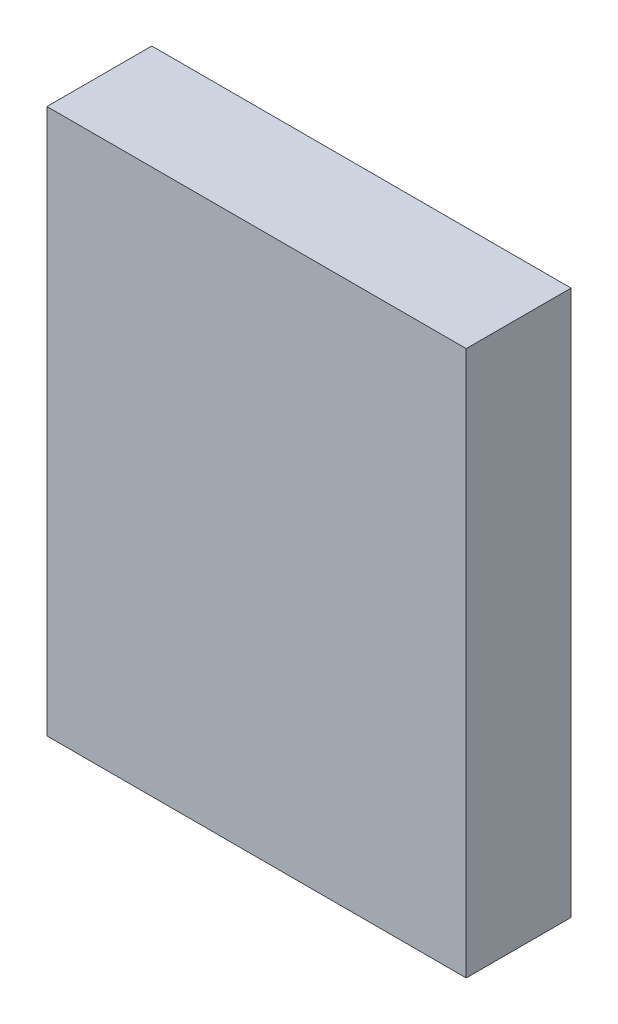
from build123d import *

# Parameters (mm, degrees)
SKETCH1_W           = 2
SKETCH1_H           = 0.5
BOSS_EXTRUDE1_DEPTH = 2.6


with BuildPart() as part:
    # Sketch1 → Boss-Extrude1 (new body)
    with BuildSketch(Plane(origin=(0, 0, 0), x_dir=(1, 0, 0), z_dir=(0, 1, 0))):
        with Locations((1, 0.25)):
            Rectangle(SKETCH1_W, SKETCH1_H)
    extrude(amount=BOSS_EXTRUDE1_DEPTH)


solid = part.part
